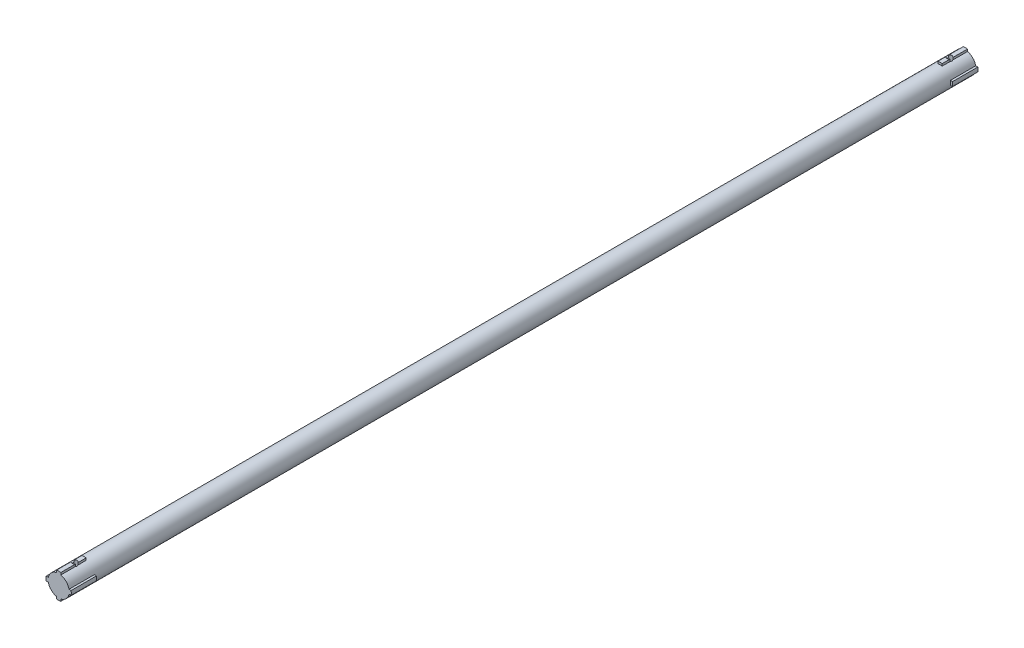
from build123d import *

# Parameters (mm, degrees)
SKETCH1_R           = 12.5
BOSS_EXTRUDE1_DEPTH = 537
BOSS_EXTRUDE2_DEPTH = 30
CIRPATTERN1_COUNT   = 4
SKETCH4_R           = 3
CUT_EXTRUDE1_DEPTH  = 538.418831081


# Read off the part's stored shape, not the designer's step: Mirror1
with BuildPart() as part:
    # Sketch1 → Boss-Extrude1 (new body)
    with BuildSketch(Plane.XY):
        Circle(SKETCH1_R)
    extrude(amount=BOSS_EXTRUDE1_DEPTH)

    # Sketch3 → Boss-Extrude2 (add)
    with BuildSketch(Plane(origin=(0, 0, 0), x_dir=(-1, 0, 0), z_dir=(0, 0, -1))):
        with BuildLine():
            Line((-2.5, 14.790199458), (-2.5, 12.247448714))
            ThreePointArc((-2.5, 12.247448714), (0, 12.5), (2.5, 12.247448714))
            Line((2.5, 12.247448714), (2.5, 14.790199458))
            ThreePointArc((2.5, 14.790199458), (0, 15), (-2.5, 14.790199458))
        make_face()
    boss_extrude2 = extrude(amount=-BOSS_EXTRUDE2_DEPTH)

    # CirPattern1: Boss-Extrude2 ×4 about axis
    cirpattern1_axis = Axis((0, 0, 0), (0, 0, 1))
    for i in range(1, CIRPATTERN1_COUNT):
        add(boss_extrude2.rotate(cirpattern1_axis, i * 360 / CIRPATTERN1_COUNT))

    # Sketch4 → Cut-Extrude1 (cut, symmetric)
    with BuildSketch(Plane(origin=(0, 0, 0), x_dir=(1, 0, 0), z_dir=(0, 1, 0))):
        with Locations(Location((0, -19, 0), (0, 0, 213.557309762))):
            Circle(SKETCH4_R)
    extrude(amount=CUT_EXTRUDE1_DEPTH, both=True, mode=Mode.SUBTRACT)

    # Mirror1: part across plane


with BuildPart() as part_1:
    add(part.part)
    add(part.part.mirror(Plane.XY.offset(537)))


solid = part_1.part
